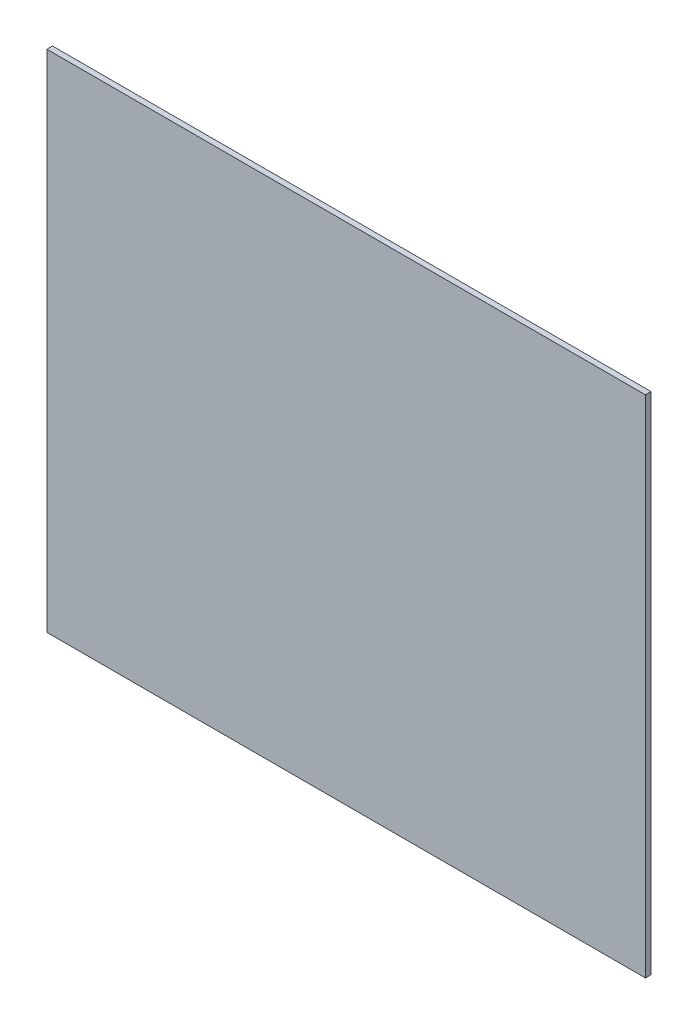
from build123d import *

# Parameters (mm, degrees)
SKETCH1_W           = 320
SKETCH1_H           = 270
BOSS_EXTRUDE1_DEPTH = 3


with BuildPart() as part:
    # Sketch1 → Boss-Extrude1 (new body)
    with BuildSketch(Plane.XY):
        Rectangle(SKETCH1_W, SKETCH1_H)
    extrude(amount=BOSS_EXTRUDE1_DEPTH)


solid = part.part
